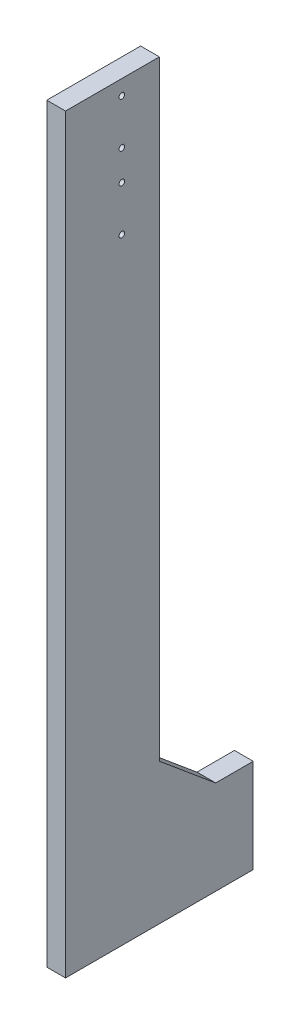
from build123d import *

# Parameters (mm, degrees)
SKETCH_1_R        = 1.5
EXTRUDE_579_DEPTH = 10


with BuildPart() as part:
    # Эскиз1 → Extrude 579 (new body)
    with BuildSketch(Plane(origin=(0, 0, 0), x_dir=(0, 0, -1), z_dir=(1, 0, 0))):
        Polygon((0, 0), (100, 0), (100, 50), (80, 50), (50, 75), (50, 400), (0, 400), align=None)
        with Locations((30, 392)):
            Circle(SKETCH_1_R, mode=Mode.SUBTRACT)
        with Locations((30, 368)):
            Circle(SKETCH_1_R, mode=Mode.SUBTRACT)
        with Locations((30, 352)):
            Circle(SKETCH_1_R, mode=Mode.SUBTRACT)
        with Locations((30, 328)):
            Circle(SKETCH_1_R, mode=Mode.SUBTRACT)
    extrude(amount=EXTRUDE_579_DEPTH)


solid = part.part
